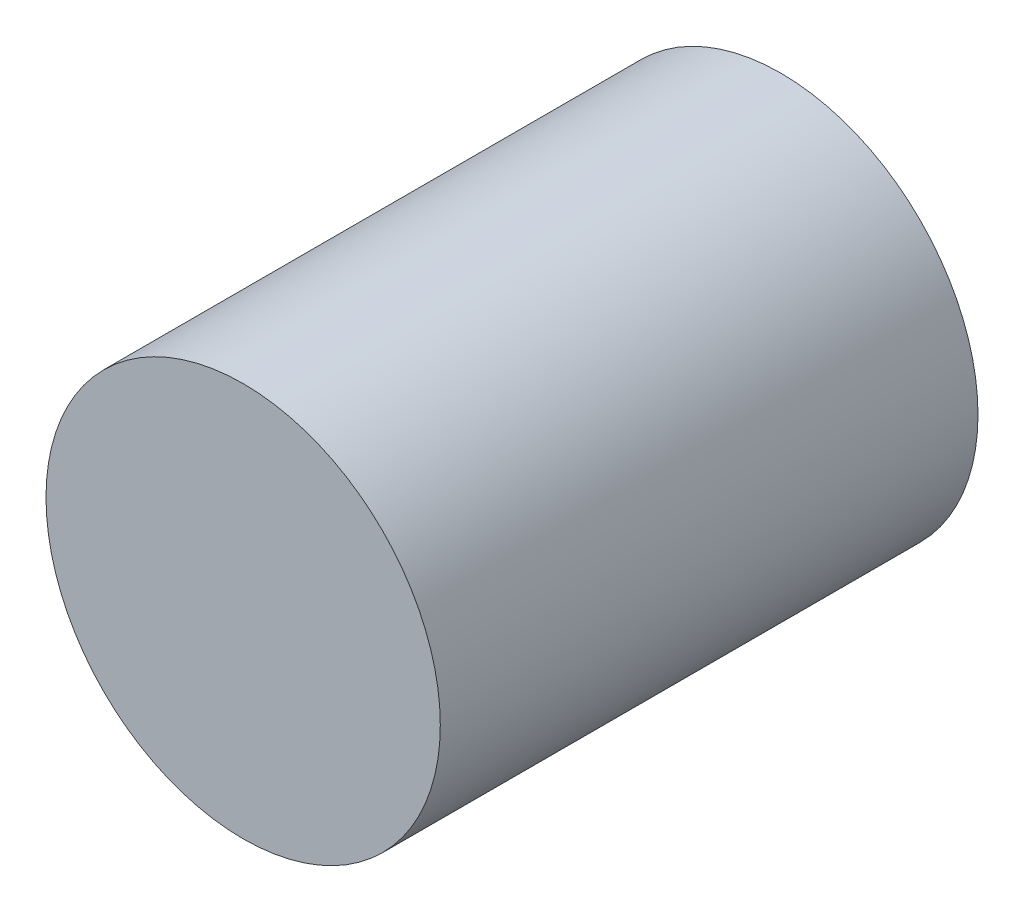
from build123d import *

# Parameters (mm, degrees)
SKETCH1_R           = 22
BOSS_EXTRUDE1_DEPTH = 30


with BuildPart() as part:
    # Sketch1 → Boss-Extrude1 (new, symmetric)
    with BuildSketch(Plane.XY):
        Circle(SKETCH1_R)
    extrude(amount=BOSS_EXTRUDE1_DEPTH, both=True)


solid = part.part
